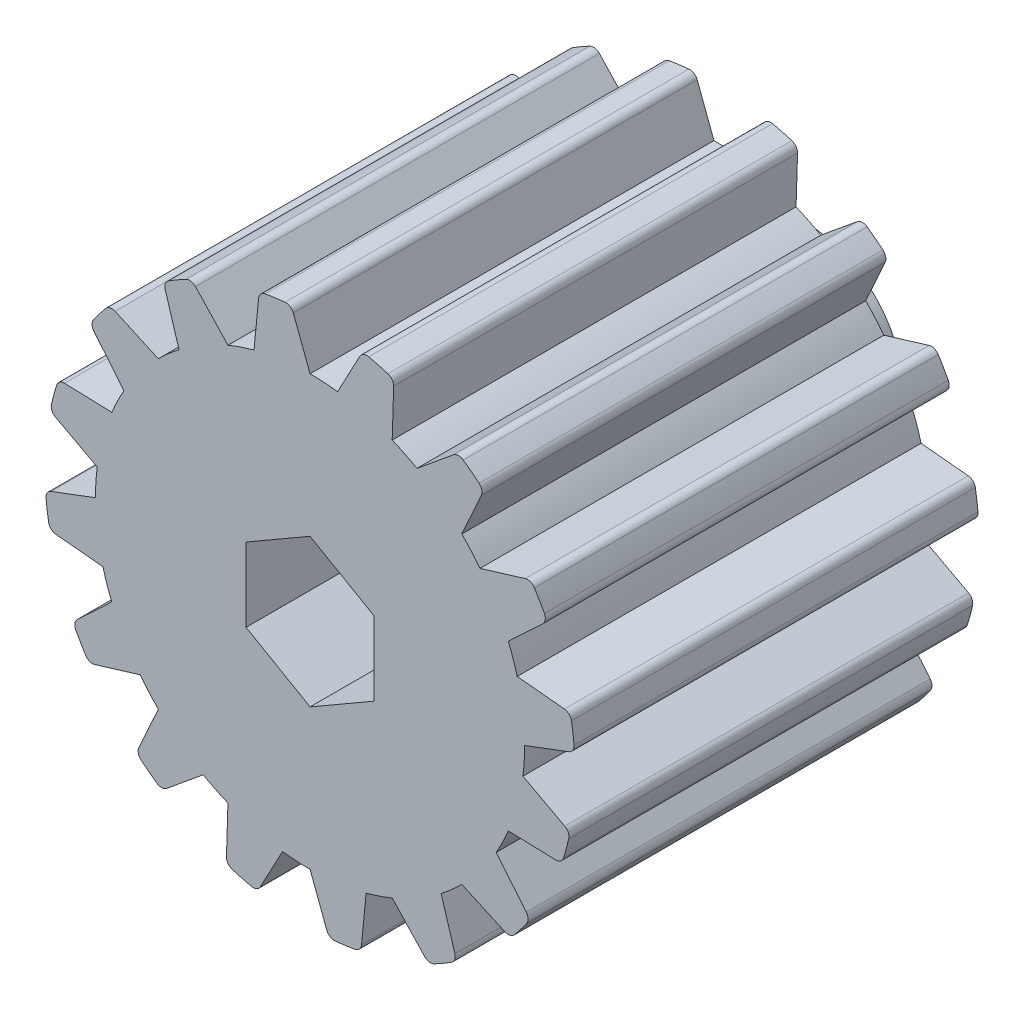
from build123d import *

# Parameters (mm, degrees)
SALIENTE_EXTRUIR1_DEPTH    = 15
CROQUIS5_R                 = 4.5
SALIENTE_EXTRUIR2_DEPTH    = 6
ESCALA1_SCALE              = 1.5
CORTAR_EXTRUIR3_DEPTH      = 38.7502155
CORTAR_EXTRUIR3_DEPTH_BACK = 5.8
CROQUIS7_R                 = 10
CROQUIS8_R                 = 5.5
SALIENTE_EXTRUIR3_DEPTH    = 1.87
CORTAR_EXTRUIR4_DEPTH      = 35.538871873
CORTAR_EXTRUIR4_DEPTH_BACK = 35.538871873


with BuildPart() as part:
    # Croquis2 → Saliente-Extruir1 (new body)
    with BuildSketch(Plane.XY):
        with BuildLine():
            Line((-2.081696937, 7.693567449), (-1.911179214, 9.445287663))
            ThreePointArc((-1.911179214, 9.445287663), (-1.831468139, 9.618345927), (-1.663611198, 9.708496165))
            ThreePointArc((-1.663611198, 9.708496165), (-1.297642615, 9.764149919), (-0.929841298, 9.806013214))
            ThreePointArc((-0.929841298, 9.806013214), (-0.744265019, 9.762833784), (-0.622120698, 9.616601835))
            Line((-0.622120698, 9.616601835), (0, 7.97022222))
            ThreePointArc((0, 7.97022222), (0.511536449, 7.953789832), (1.020963606, 7.904560428))
            Line((1.020963606, 7.904560428), (1.848855744, 9.457684572))
            ThreePointArc((1.848855744, 9.457684572), (1.988725705, 9.587065453), (2.1783043, 9.606117341))
            ThreePointArc((2.1783043, 9.606117341), (2.537712953, 9.517484592), (2.893537451, 9.415409764))
            ThreePointArc((2.893537451, 9.415409764), (3.048463524, 9.304500205), (3.105349619, 9.122656892))
            Line((3.105349619, 9.122656892), (3.050071996, 7.363525179))
            ThreePointArc((3.050071996, 7.363525179), (3.516381649, 7.152587108), (3.968191694, 6.912155736))
            Line((3.968191694, 6.912155736), (5.327419174, 8.030234739))
            ThreePointArc((5.327419174, 8.030234739), (5.506154088, 8.09624117), (5.688592714, 8.041294232))
            ThreePointArc((5.688592714, 8.041294232), (5.986724728, 7.821868513), (6.276401353, 7.591395527))
            ThreePointArc((6.276401353, 7.591395527), (6.37709113, 7.429640815), (6.360058606, 7.239870134))
            Line((6.360058606, 7.239870134), (5.635798179, 5.635798179))
            ThreePointArc((5.635798179, 5.635798179), (5.985889619, 5.262467835), (6.311298569, 4.867437992))
            Line((6.311298569, 4.867437992), (7.994931329, 5.380254461))
            ThreePointArc((7.994931329, 5.380254461), (8.185320425, 5.372837562), (8.332844455, 5.252256971))
            ThreePointArc((8.332844455, 5.252256971), (8.524311933, 4.935443857), (8.703740045, 4.611660138))
            ThreePointArc((8.703740045, 4.611660138), (8.73486442, 4.42368596), (8.646506324, 4.254878777))
            Line((8.646506324, 4.254878777), (7.363525179, 3.050071996))
            ThreePointArc((7.363525179, 3.050071996), (7.544100156, 2.571185538), (7.693567449, 2.081696937))
            Line((7.693567449, 2.081696937), (9.445287663, 1.911179214))
            ThreePointArc((9.445287663, 1.911179214), (9.618345927, 1.831468139), (9.708496165, 1.663611198))
            ThreePointArc((9.708496165, 1.663611198), (9.764149919, 1.297642615), (9.806013214, 0.929841298))
            ThreePointArc((9.806013214, 0.929841298), (9.762833784, 0.744265019), (9.616601835, 0.622120698))
            Line((9.616601835, 0.622120698), (7.97022222, 0))
            ThreePointArc((7.97022222, 0), (7.953789832, -0.511536449), (7.904560428, -1.020963606))
            Line((7.904560428, -1.020963606), (9.457684572, -1.848855744))
            ThreePointArc((9.457684572, -1.848855744), (9.587065453, -1.988725705), (9.606117341, -2.1783043))
            ThreePointArc((9.606117341, -2.1783043), (9.517484592, -2.537712953), (9.415409764, -2.893537451))
            ThreePointArc((9.415409764, -2.893537451), (9.304500205, -3.048463524), (9.122656892, -3.105349619))
            Line((9.122656892, -3.105349619), (7.363525179, -3.050071996))
            ThreePointArc((7.363525179, -3.050071996), (7.152587108, -3.516381649), (6.912155736, -3.968191694))
            Line((6.912155736, -3.968191694), (8.030234739, -5.327419174))
            ThreePointArc((8.030234739, -5.327419174), (8.09624117, -5.506154088), (8.041294232, -5.688592714))
            ThreePointArc((8.041294232, -5.688592714), (7.821868513, -5.986724728), (7.591395527, -6.276401353))
            ThreePointArc((7.591395527, -6.276401353), (7.429640815, -6.37709113), (7.239870134, -6.360058606))
            Line((7.239870134, -6.360058606), (5.635798179, -5.635798179))
            ThreePointArc((5.635798179, -5.635798179), (5.262467835, -5.985889619), (4.867437992, -6.311298569))
            Line((4.867437992, -6.311298569), (5.380254461, -7.994931329))
            ThreePointArc((5.380254461, -7.994931329), (5.372837562, -8.185320425), (5.252256971, -8.332844455))
            ThreePointArc((5.252256971, -8.332844455), (4.935443857, -8.524311933), (4.611660138, -8.703740045))
            ThreePointArc((4.611660138, -8.703740045), (4.42368596, -8.73486442), (4.254878777, -8.646506324))
            Line((4.254878777, -8.646506324), (3.050071996, -7.363525179))
            ThreePointArc((3.050071996, -7.363525179), (2.571185538, -7.544100156), (2.081696937, -7.693567449))
            Line((2.081696937, -7.693567449), (1.911179214, -9.445287663))
            ThreePointArc((1.911179214, -9.445287663), (1.831468139, -9.618345927), (1.663611198, -9.708496165))
            ThreePointArc((1.663611198, -9.708496165), (1.297642615, -9.764149919), (0.929841298, -9.806013214))
            ThreePointArc((0.929841298, -9.806013214), (0.744265019, -9.762833784), (0.622120698, -9.616601835))
            Line((0.622120698, -9.616601835), (0, -7.97022222))
            ThreePointArc((0, -7.97022222), (-0.511536449, -7.953789832), (-1.020963606, -7.904560428))
            Line((-1.020963606, -7.904560428), (-1.848855744, -9.457684572))
            ThreePointArc((-1.848855744, -9.457684572), (-1.988725705, -9.587065453), (-2.1783043, -9.606117341))
            ThreePointArc((-2.1783043, -9.606117341), (-2.537712953, -9.517484592), (-2.893537451, -9.415409764))
            ThreePointArc((-2.893537451, -9.415409764), (-3.048463524, -9.304500205), (-3.105349619, -9.122656892))
            Line((-3.105349619, -9.122656892), (-3.050071996, -7.363525179))
            ThreePointArc((-3.050071996, -7.363525179), (-3.516381649, -7.152587108), (-3.968191694, -6.912155736))
            Line((-3.968191694, -6.912155736), (-5.327419174, -8.030234739))
            ThreePointArc((-5.327419174, -8.030234739), (-5.506154088, -8.09624117), (-5.688592714, -8.041294232))
            ThreePointArc((-5.688592714, -8.041294232), (-5.986724728, -7.821868513), (-6.276401353, -7.591395527))
            ThreePointArc((-6.276401353, -7.591395527), (-6.37709113, -7.429640815), (-6.360058606, -7.239870134))
            Line((-6.360058606, -7.239870134), (-5.635798179, -5.635798179))
            ThreePointArc((-5.635798179, -5.635798179), (-5.985889619, -5.262467835), (-6.311298569, -4.867437992))
            Line((-6.311298569, -4.867437992), (-7.994931329, -5.380254461))
            ThreePointArc((-7.994931329, -5.380254461), (-8.185320425, -5.372837562), (-8.332844455, -5.252256971))
            ThreePointArc((-8.332844455, -5.252256971), (-8.524311933, -4.935443857), (-8.703740045, -4.611660138))
            ThreePointArc((-8.703740045, -4.611660138), (-8.73486442, -4.42368596), (-8.646506324, -4.254878777))
            Line((-8.646506324, -4.254878777), (-7.363525179, -3.050071996))
            ThreePointArc((-7.363525179, -3.050071996), (-7.544100156, -2.571185538), (-7.693567449, -2.081696937))
            Line((-7.693567449, -2.081696937), (-9.445287663, -1.911179214))
            ThreePointArc((-9.445287663, -1.911179214), (-9.618345927, -1.831468139), (-9.708496165, -1.663611198))
            ThreePointArc((-9.708496165, -1.663611198), (-9.764149919, -1.297642615), (-9.806013214, -0.929841298))
            ThreePointArc((-9.806013214, -0.929841298), (-9.762833784, -0.744265019), (-9.616601835, -0.622120698))
            Line((-9.616601835, -0.622120698), (-7.97022222, 0))
            ThreePointArc((-7.97022222, 0), (-7.953789832, 0.511536449), (-7.904560428, 1.020963606))
            Line((-7.904560428, 1.020963606), (-9.457684572, 1.848855744))
            ThreePointArc((-9.457684572, 1.848855744), (-9.587065453, 1.988725705), (-9.606117341, 2.1783043))
            ThreePointArc((-9.606117341, 2.1783043), (-9.517484592, 2.537712953), (-9.415409764, 2.893537451))
            ThreePointArc((-9.415409764, 2.893537451), (-9.304500205, 3.048463524), (-9.122656892, 3.105349619))
            Line((-9.122656892, 3.105349619), (-7.363525179, 3.050071996))
            ThreePointArc((-7.363525179, 3.050071996), (-7.152587108, 3.516381649), (-6.912155736, 3.968191694))
            Line((-6.912155736, 3.968191694), (-8.030234739, 5.327419174))
            ThreePointArc((-8.030234739, 5.327419174), (-8.09624117, 5.506154088), (-8.041294232, 5.688592714))
            ThreePointArc((-8.041294232, 5.688592714), (-7.821868513, 5.986724728), (-7.591395527, 6.276401353))
            ThreePointArc((-7.591395527, 6.276401353), (-7.429640815, 6.37709113), (-7.239870134, 6.360058606))
            Line((-7.239870134, 6.360058606), (-5.635798179, 5.635798179))
            ThreePointArc((-5.635798179, 5.635798179), (-5.262467835, 5.985889619), (-4.867437992, 6.311298569))
            Line((-4.867437992, 6.311298569), (-5.380254461, 7.994931329))
            ThreePointArc((-5.380254461, 7.994931329), (-5.372837562, 8.185320425), (-5.252256971, 8.332844455))
            ThreePointArc((-5.252256971, 8.332844455), (-4.935443857, 8.524311933), (-4.611660138, 8.703740045))
            ThreePointArc((-4.611660138, 8.703740045), (-4.42368596, 8.73486442), (-4.254878777, 8.646506324))
            Line((-4.254878777, 8.646506324), (-3.050071996, 7.363525179))
            ThreePointArc((-3.050071996, 7.363525179), (-2.571185538, 7.544100156), (-2.081696937, 7.693567449))
        make_face()
    extrude(amount=SALIENTE_EXTRUIR1_DEPTH)

    # Croquis5 → Saliente-Extruir2 (add)
    with BuildSketch(Plane(origin=(0, 0, 0), x_dir=(-1, 0, 0), z_dir=(0, 0, -1))):
        Circle(CROQUIS5_R)
    extrude(amount=SALIENTE_EXTRUIR2_DEPTH)


with BuildPart() as part_1:
    # Escala1: scaled about (0, 0, 0)
    add(part.part.scale(ESCALA1_SCALE))

    # Croquis7 → Cortar-Extruir3 (cut, two sides: drawn at the far end of the back side and taken through both)
    with BuildSketch(Plane(origin=(0, 0, -9), x_dir=(-1, 0, 0), z_dir=(0, 0, -1)).offset(-CORTAR_EXTRUIR3_DEPTH_BACK)):
        Circle(CROQUIS7_R)
    extrude(amount=CORTAR_EXTRUIR3_DEPTH + CORTAR_EXTRUIR3_DEPTH_BACK, mode=Mode.SUBTRACT)

    # Croquis8 → Saliente-Extruir3 (add)
    with BuildSketch(Plane(origin=(0, 0, -3.2), x_dir=(-1, 0, 0), z_dir=(0, 0, -1))):
        Circle(CROQUIS8_R)
    extrude(amount=SALIENTE_EXTRUIR3_DEPTH)

    # Croquis10 → Cortar-Extruir4 (cut, two sides: drawn at the far end of the back side and taken through both)
    with BuildSketch(Plane.XY.offset(22.5).offset(-CORTAR_EXTRUIR4_DEPTH_BACK)):
        Polygon((0, 4.115470054), (-3.564101615, 2.057735027), (-3.564101615, -2.057735027), (0, -4.115470054), (3.564101615, -2.057735027), (3.564101615, 2.057735027), align=None)
    extrude(amount=CORTAR_EXTRUIR4_DEPTH + CORTAR_EXTRUIR4_DEPTH_BACK, mode=Mode.SUBTRACT)


solid = part_1.part
